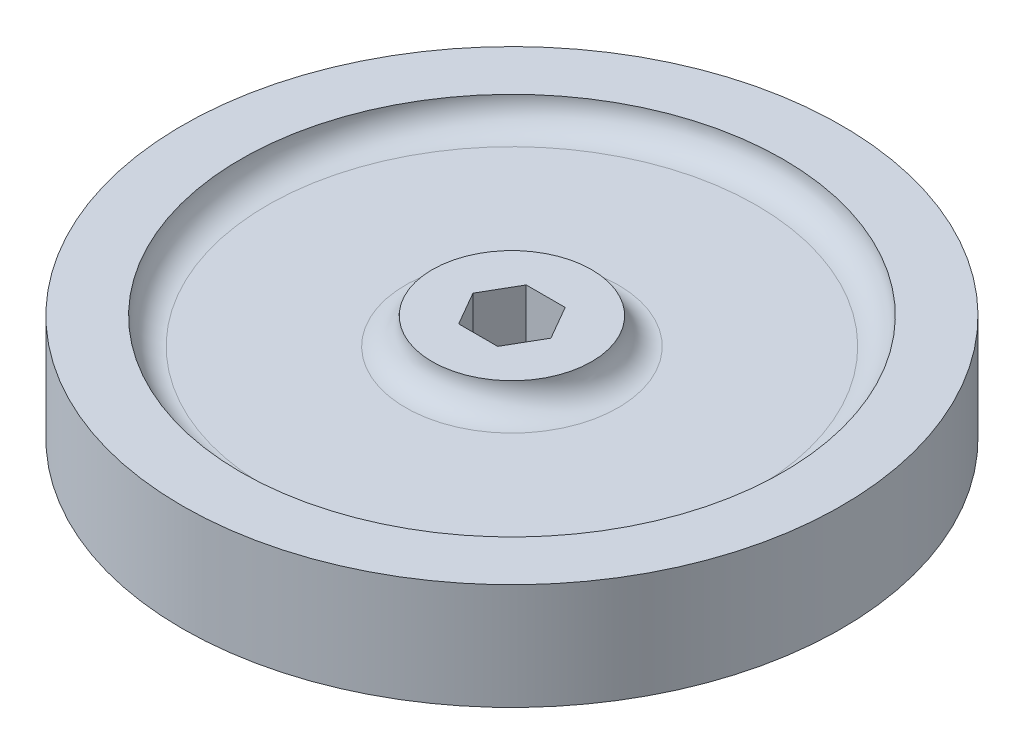
from build123d import *

# Parameters (mm, degrees)
ESQUISSE1_R             = 55
BOSS_EXTRU_1_DEPTH      = 10
ESQUISSE1_11_R          = 51
ESQUISSE1_11_R_2        = 15
ENL_V_MAT_EXTRU_1_DEPTH = 5
CONG_1_R                = 5
CONG_1_OF_SYM_TRIE1_R   = 5
ESQUISSE1_14_R          = 62
ESQUISSE1_14_R_2        = 55
BOSS_EXTRU_4_DEPTH      = 20


with BuildPart() as part:
    # Esquisse1 → Boss.-Extru.1 (new body)
    with BuildSketch(Plane(origin=(0, 0, 0), x_dir=(1, 0, 0), z_dir=(0, 1, 0))):
        with Locations(Location((0, 0, 0), (0, 0, 270))):
            Circle(ESQUISSE1_R)
        Polygon((-7.332348419, 0), (-3.666174209, -6.35), (3.666174209, -6.35), (7.332348419, 0), (3.666174209, 6.35), (-3.666174209, 6.35), align=None, mode=Mode.SUBTRACT)
    boss_extru_1 = extrude(amount=BOSS_EXTRU_1_DEPTH)

    # Esquisse1<11> → Enlèv. mat.-Extru.1 (cut)
    with BuildSketch(Plane(origin=(0, 0, 0), x_dir=(1, 0, 0), z_dir=(0, 1, 0))):
        with Locations(Location((0, 0, 0), (0, 0, 270))):
            Circle(ESQUISSE1_11_R)
        with Locations(Location((0, 0, 0), (0, 0, 270))):
            Circle(ESQUISSE1_11_R_2, mode=Mode.SUBTRACT)
    enl_v_mat_extru_1 = extrude(amount=ENL_V_MAT_EXTRU_1_DEPTH, mode=Mode.SUBTRACT)

    # Congé1
    cong_1_edges = [part.edges().sort_by_distance(p)[0] for p in [
        (0, 5, -51),
        (0, 5, -15),
    ]]
    fillet(cong_1_edges, radius=CONG_1_R - 0.0001)  # a hair under: the kernel refuses the full size

    # Symétrie1: Boss.-Extru.1, Enlèv. mat.-Extru.1 across plane
    add(boss_extru_1.mirror(Plane.ZX.offset(10)))
    add(enl_v_mat_extru_1.mirror(Plane.ZX.offset(10)), mode=Mode.SUBTRACT)

    # Congé1 of Symétrie1
    cong_1_of_sym_trie1_edges = [part.edges().sort_by_distance(p)[0] for p in [
        (0, 15, -51),
        (0, 15, -15),
    ]]
    fillet(cong_1_of_sym_trie1_edges, radius=CONG_1_OF_SYM_TRIE1_R - 0.0001)  # a hair under: the kernel refuses the full size

    # Esquisse1<14> → Boss.-Extru.4 (add)
    with BuildSketch(Plane(origin=(0, 0, 0), x_dir=(1, 0, 0), z_dir=(0, 1, 0))):
        with Locations(Location((0, 0, 0), (0, 0, 270))):
            Circle(ESQUISSE1_14_R)
        Circle(ESQUISSE1_14_R_2, mode=Mode.SUBTRACT)
    extrude(amount=BOSS_EXTRU_4_DEPTH)


solid = part.part
